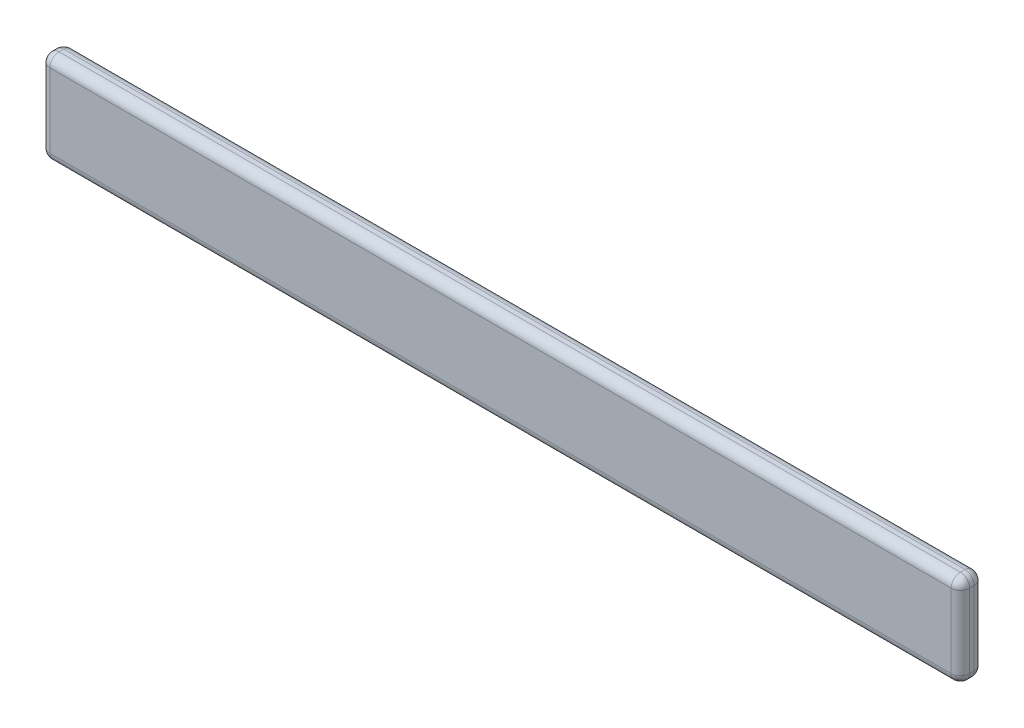
from build123d import *

# Parameters (mm, degrees)
SKETCH2_W           = 50
SKETCH2_H           = 200
BOSS_EXTRUDE1_DEPTH = 1990
FILLET1_R           = 20


with BuildPart() as part:
    # Sketch2 → Boss-Extrude1 (new body)
    with BuildSketch(Plane(origin=(0, 0, 0), x_dir=(0, 0, -1), z_dir=(1, 0, 0))):
        Rectangle(SKETCH2_W, SKETCH2_H)
    extrude(amount=BOSS_EXTRUDE1_DEPTH)

    # Fillet1
    fillet1_edges = [part.edges().sort_by_distance(p)[0] for p in [
        (0, -100, 0),
        (1990, -100, 0),
        (1990, 100, 0),
        (0, 100, 0),
        (995, -100, -25),
        (1990, 0, -25),
        (995, 100, -25),
        (0, 0, -25),
        (995, 100, 25),
        (1990, 0, 25),
        (995, -100, 25),
        (0, 0, 25),
    ]]
    fillet(fillet1_edges, radius=FILLET1_R)


solid = part.part
